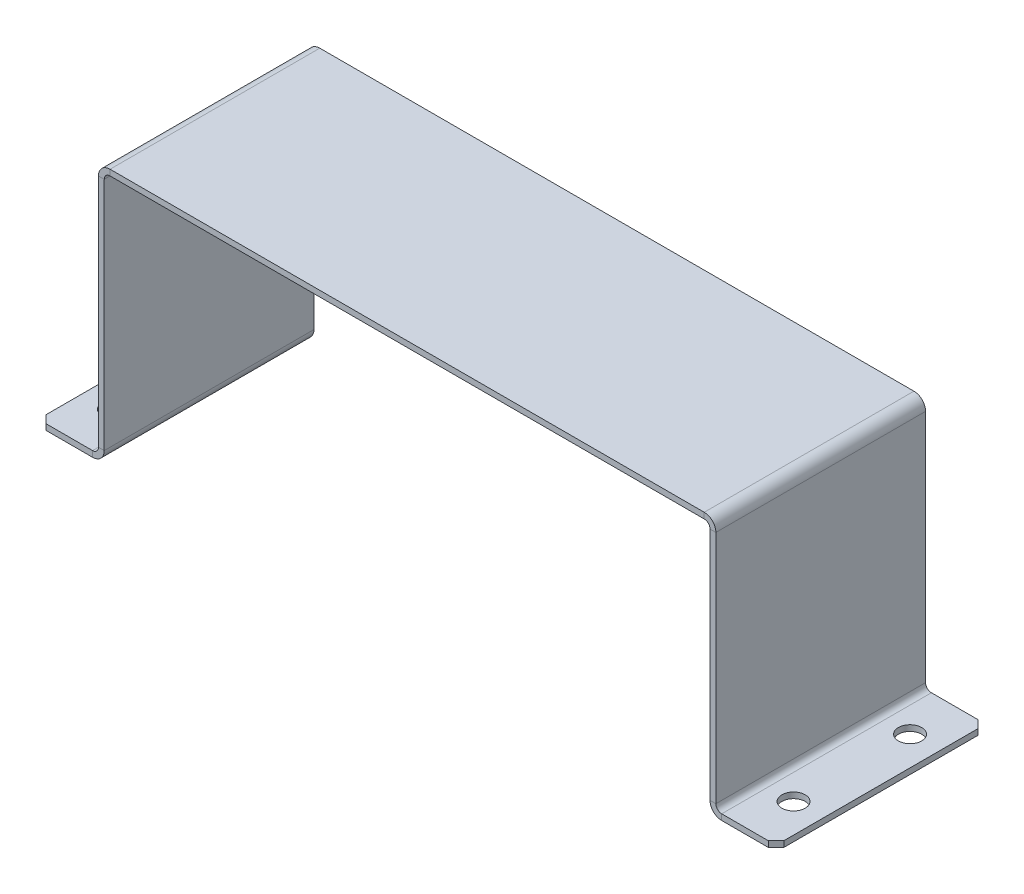
from build123d import *

# Parameters (mm, degrees)
BASE_FLANGE1_DEPTH = 27
SKETCH2_R          = 3
CUT_EXTRUDE1_DEPTH = 10
CHAMFER1_SIZE      = 2


# Sheet-metal steps are written as plain solids
with BuildPart() as part:
    # Sketch1 → Base-Flange1 (new, symmetric)
    with BuildSketch(Plane.XY):
        with BuildLine():
            Line((95, -32.5), (81, -32.5))
            ThreePointArc((81, -32.5), (78.878679656, -31.621320344), (78, -29.5))
            Line((78, -29.5), (78, 31))
            ThreePointArc((78, 31), (77.560660172, 32.060660172), (76.5, 32.5))
            Line((76.5, 32.5), (-76.5, 32.5))
            ThreePointArc((-76.5, 32.5), (-77.560660172, 32.060660172), (-78, 31))
            Line((-78, 31), (-78, -29.5))
            ThreePointArc((-78, -29.5), (-78.878679656, -31.621320344), (-81, -32.5))
            Line((-81, -32.5), (-95, -32.5))
            Line((-95, -32.5), (-95, -31))
            Line((-95, -31), (-81, -31))
            ThreePointArc((-81, -31), (-79.939339828, -30.560660172), (-79.5, -29.5))
            Line((-79.5, -29.5), (-79.5, 31))
            ThreePointArc((-79.5, 31), (-78.621320344, 33.121320344), (-76.5, 34))
            Line((-76.5, 34), (76.5, 34))
            ThreePointArc((76.5, 34), (78.621320344, 33.121320344), (79.5, 31))
            Line((79.5, 31), (79.5, -29.5))
            ThreePointArc((79.5, -29.5), (79.939339828, -30.560660172), (81, -31))
            Line((81, -31), (95, -31))
            Line((95, -31), (95, -32.5))
        make_face()
    extrude(amount=BASE_FLANGE1_DEPTH, both=True)

    # Sketch2 → Cut-Extrude1 (cut)
    with BuildSketch(Plane(origin=(0, -31, 0), x_dir=(1, 0, 0), z_dir=(0, 1, 0))):
        with Locations(Location((-87.5, -15, 0), (0, 0, 270))):
            Circle(SKETCH2_R)
        with Locations(Location((87.5, -15, 0), (0, 0, 90))):
            Circle(SKETCH2_R)
        with Locations(Location((87.5, 15, 0), (0, 0, 270))):
            Circle(SKETCH2_R)
        with Locations(Location((-87.5, 15, 0), (0, 0, 90))):
            Circle(SKETCH2_R)
    extrude(amount=-CUT_EXTRUDE1_DEPTH, mode=Mode.SUBTRACT)

    # Chamfer1
    chamfer1_edges = [part.edges().sort_by_distance(p)[0] for p in [
        (95, -31.75, -27),
        (-95, -31.75, -27),
        (95, -31.75, 27),
        (-95, -31.75, 27),
    ]]
    chamfer(chamfer1_edges, length=CHAMFER1_SIZE)


solid = part.part
